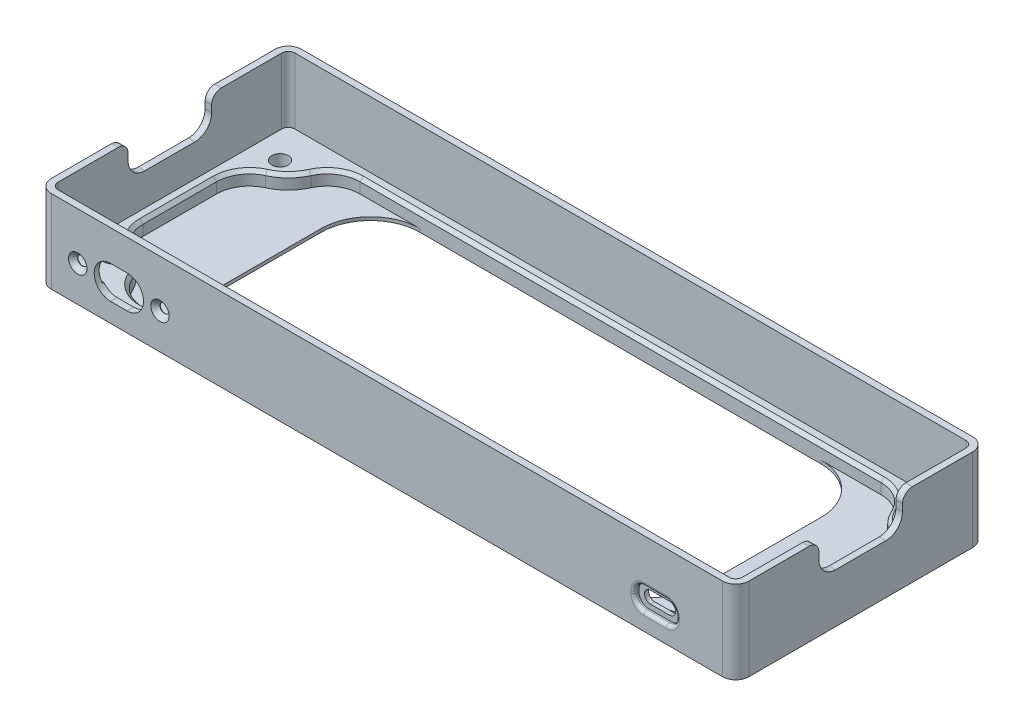
from build123d import *

# Parameters (mm, degrees)
BOSS_EXTRUDE1_DEPTH = 5.2
FILLET1_R           = 10
BOSS_EXTRUDE2_DEPTH = 1
SKETCH2_R           = 2.5
CUT_EXTRUDE1_DEPTH  = 5.2
BOSS_EXTRUDE3_DEPTH = 20
SKETCH7_W           = 15.78
SKETCH7_H           = 10
BOSS_EXTRUDE5_DEPTH = 0.75
CUT_EXTRUDE2_DEPTH  = 10
CUT_EXTRUDE3_DEPTH  = 1.5
FILLET6_R           = 1
CHAMFER1_SIZE       = 1
CUT_EXTRUDE4_DEPTH  = 3
SKETCH11_R          = 1.4
CUT_EXTRUDE5_DEPTH  = 3.5
CHAMFER2_SIZE       = 1.4
CUT_EXTRUDE6_DEPTH  = 0.5
CHAMFER3_SIZE       = 1
SKETCH13_W          = 25.4
SKETCH13_H          = 10.2
CUT_EXTRUDE7_DEPTH  = 217.847965174
FILLET7_R           = 5.1
FILLET8_R           = 3
FILLET9_R           = 15


with BuildPart() as part:
    # Sketch1 → Boss-Extrude1 (new body)
    with BuildSketch(Plane(origin=(0, 0, 0), x_dir=(1, 0, 0), z_dir=(0, 1, 0))):
        with BuildLine():
            ThreePointArc((-106, -34), (-104.828427125, -36.828427125), (-102, -38))
            Line((-102, -38), (102, -38))
            ThreePointArc((102, -38), (104.828427125, -36.828427125), (106, -34))
            Line((106, -34), (106, 34))
            ThreePointArc((106, 34), (104.828427125, 36.828427125), (102, 38))
            Line((102, 38), (-102, 38))
            ThreePointArc((-102, 38), (-104.828427125, 36.828427125), (-106, 34))
            Line((-106, 34), (-106, -34))
        make_face()
        with BuildLine():
            ThreePointArc((-87, -33), (-91.100505063, -23.100505063), (-101, -19))
            Line((-101, -19), (-101, 19))
            ThreePointArc((-101, 19), (-91.100505063, 23.100505063), (-87, 33))
            Line((-87, 33), (87, 33))
            ThreePointArc((87, 33), (91.100505063, 23.100505063), (101, 19))
            Line((101, 19), (101, -19))
            ThreePointArc((101, -19), (91.100505063, -23.100505063), (87, -33))
            Line((87, -33), (-87, -33))
        make_face(mode=Mode.SUBTRACT)
    extrude(amount=BOSS_EXTRUDE1_DEPTH)

    # Fillet1
    fillet1_edges = [part.edges().sort_by_distance(p)[0] for p in [
        (101, 2.6, -19),
        (87, 2.6, -33),
        (-87, 2.6, -33),
        (-101, 2.6, -19),
        (-101, 2.6, 19),
        (-87, 2.6, 33),
        (87, 2.6, 33),
        (101, 2.6, 19),
    ]]
    fillet(fillet1_edges, radius=FILLET1_R)

    # Sketch3 → Boss-Extrude2 (add)
    with BuildSketch(Plane(origin=(0, 0, 0), x_dir=(-1, 0, 0), z_dir=(0, -1, 0))):
        with BuildLine():
            Line((-102, -38), (-76, -38))
            Line((-76, -38), (-76, 38))
            Line((-76, 38), (-102, 38))
            ThreePointArc((-102, 38), (-104.828427125, 36.828427125), (-106, 34))
            Line((-106, 34), (-106, -34))
            ThreePointArc((-106, -34), (-104.828427125, -36.828427125), (-102, -38))
        make_face()
        with BuildLine():
            Line((102, -38), (76, -38))
            Line((76, -38), (76, 38))
            Line((76, 38), (102, 38))
            ThreePointArc((102, 38), (104.828427125, 36.828427125), (106, 34))
            Line((106, 34), (106, -34))
            ThreePointArc((106, -34), (104.828427125, -36.828427125), (102, -38))
        make_face()
    extrude(amount=-BOSS_EXTRUDE2_DEPTH)

    # Sketch2 → Cut-Extrude1 (cut)
    with BuildSketch(Plane(origin=(0, 5.2, 0), x_dir=(1, 0, 0), z_dir=(0, 1, 0))):
        with Locations(Location((-96, 25.5, 0), (0, 0, 270))):
            Circle(SKETCH2_R)
        with Locations(Location((96, 25.5, 0), (0, 0, 90))):
            Circle(SKETCH2_R)
        with Locations(Location((96, -25.5, 0), (0, 0, 270))):
            Circle(SKETCH2_R)
        with Locations(Location((-96, -25.5, 0), (0, 0, 90))):
            Circle(SKETCH2_R)
    extrude(amount=-CUT_EXTRUDE1_DEPTH, mode=Mode.SUBTRACT)

    # Sketch4 → Boss-Extrude3 (add)
    with BuildSketch(Plane(origin=(0, 5.2, 0), x_dir=(1, 0, 0), z_dir=(0, 1, 0))):
        with BuildLine():
            Line((-102, 38), (102, 38))
            ThreePointArc((102, 38), (104.828427125, 36.828427125), (106, 34))
            Line((106, 34), (106, -34))
            ThreePointArc((106, -34), (104.828427125, -36.828427125), (102, -38))
            Line((102, -38), (-102, -38))
            ThreePointArc((-102, -38), (-104.828427125, -36.828427125), (-106, -34))
            Line((-106, -34), (-106, 34))
            ThreePointArc((-106, 34), (-104.828427125, 36.828427125), (-102, 38))
        make_face()
        with BuildLine():
            Line((102, -36), (-102, -36))
            ThreePointArc((-102, -36), (-103.414213562, -35.414213562), (-104, -34))
            Line((-104, -34), (-104, 34))
            ThreePointArc((-104, 34), (-103.414213562, 35.414213562), (-102, 36))
            Line((-102, 36), (102, 36))
            ThreePointArc((102, 36), (103.414213562, 35.414213562), (104, 34))
            Line((104, 34), (104, -34))
            ThreePointArc((104, -34), (103.414213562, -35.414213562), (102, -36))
        make_face(mode=Mode.SUBTRACT)
    extrude(amount=BOSS_EXTRUDE3_DEPTH)

    # Sketch7 → Boss-Extrude5 (add)
    with BuildSketch(Plane(origin=(0, 0, 36), x_dir=(-1, 0, 0), z_dir=(0, 0, -1))):
        with Locations((-81.5, 10.2)):
            Rectangle(SKETCH7_W, SKETCH7_H)
    extrude(amount=BOSS_EXTRUDE5_DEPTH)

    # Sketch6 → Cut-Extrude2 (cut)
    with BuildSketch(Plane.XY.offset(38)):
        with BuildLine():
            Line((84.39, 10.34), (78.61, 10.34))
            ThreePointArc((78.61, 10.34), (76.78, 8.51), (78.61, 6.68))
            Line((78.61, 6.68), (84.39, 6.68))
            ThreePointArc((84.39, 6.68), (86.22, 8.51), (84.39, 10.34))
        make_face()
    extrude(amount=-CUT_EXTRUDE2_DEPTH, mode=Mode.SUBTRACT)

    # Sketch8 → Cut-Extrude3 (cut)
    with BuildSketch(Plane.XY.offset(38)):
        with BuildLine():
            Line((78.11, 11.84), (84.89, 11.84))
            ThreePointArc((84.89, 11.84), (87.011320344, 10.961320344), (87.89, 8.84))
            Line((87.89, 8.84), (87.89, 8.18))
            ThreePointArc((87.89, 8.18), (87.011320344, 6.058679656), (84.89, 5.18))
            Line((84.89, 5.18), (78.11, 5.18))
            ThreePointArc((78.11, 5.18), (75.988679656, 6.058679656), (75.11, 8.18))
            Line((75.11, 8.18), (75.11, 8.84))
            ThreePointArc((75.11, 8.84), (75.988679656, 10.961320344), (78.11, 11.84))
        make_face()
    extrude(amount=-CUT_EXTRUDE3_DEPTH, mode=Mode.SUBTRACT)

    # Fillet6
    fillet6_edges = [part.edges().sort_by_distance(p)[0] for p in [
        (87.011320344, 10.961320344, 38),
        (81.5, 11.84, 38),
        (75.988679656, 10.961320344, 38),
        (75.11, 8.51, 38),
        (75.988679656, 6.058679656, 38),
        (81.5, 5.18, 38),
        (87.011320344, 6.058679656, 38),
        (87.89, 8.51, 38),
    ]]
    fillet(fillet6_edges, radius=FILLET6_R)

    # Chamfer1
    # the kernel refuses this chamfer: 1 mm, written as the material it takes off along each edge
    with BuildSketch(Plane(origin=(89.39, 5.2, 35.25), x_dir=(0.027495876610582105, 0, 0.999621916911297), z_dir=(0, 1, 0))) as chamfer1_piece_1_section:
        Polygon((CHAMFER1_SIZE * 0.999621916911, -CHAMFER1_SIZE * 0.0274958766106), (-CHAMFER1_SIZE * 0.0274958766106, -CHAMFER1_SIZE * 0.999621916911), (0, 0), align=None)
    chamfer1_piece_1 = extrude(amount=12.571682988, mode=Mode.PRIVATE)
    chamfer1_piece_1 = split(chamfer1_piece_1, bisect_by=Plane(origin=(89.03804089, 11.485841494, 36), z_dir=(0, 0, -1)), keep=Keep.TOP, mode=Mode.PRIVATE)
    add(chamfer1_piece_1, mode=Mode.SUBTRACT)
    with BuildSketch(Plane(origin=(73.61, 17.771682988, 35.25), x_dir=(-0.027495876610582105, 0, 0.999621916911297), z_dir=(0, -1, 0))) as chamfer1_piece_2_section:
        Polygon((CHAMFER1_SIZE * 0.999621916911, -CHAMFER1_SIZE * 0.0274958766106), (-CHAMFER1_SIZE * 0.0274958766106, -CHAMFER1_SIZE * 0.999621916911), (0, 0), align=None)
    chamfer1_piece_2 = extrude(amount=12.571682988, mode=Mode.PRIVATE)
    chamfer1_piece_2 = split(chamfer1_piece_2, bisect_by=Plane(origin=(73.96195911, 11.485841494, 36), z_dir=(0, 0, -1)), keep=Keep.TOP, mode=Mode.PRIVATE)
    add(chamfer1_piece_2, mode=Mode.SUBTRACT)

    # Sketch9 → Cut-Extrude4 (cut)
    with BuildSketch(Plane.XY.offset(38)):
        with BuildLine():
            Line((-84, 15.81), (-79, 15.81))
            ThreePointArc((-79, 15.81), (-74, 10.81), (-79, 5.81))
            Line((-79, 5.81), (-84, 5.81))
            ThreePointArc((-84, 5.81), (-89, 10.81), (-84, 15.81))
        make_face()
    extrude(amount=-CUT_EXTRUDE4_DEPTH, mode=Mode.SUBTRACT)

    # Sketch11 → Cut-Extrude5 (cut)
    with BuildSketch(Plane.XY.offset(38)):
        with Locations((-94, 10.81)):
            Circle(SKETCH11_R)
        with Locations((-69, 10.81)):
            Circle(SKETCH11_R)
    extrude(amount=-CUT_EXTRUDE5_DEPTH, mode=Mode.SUBTRACT)

    # Chamfer2
    chamfer2_edges = [part.edges().sort_by_distance(p)[0] for p in [
        (-95.4, 10.81, 38),
        (-70.4, 10.81, 38),
    ]]
    chamfer(chamfer2_edges, length=CHAMFER2_SIZE)

    # Sketch12 → Cut-Extrude6 (cut)
    with BuildSketch(Plane(origin=(0, 0, 36), x_dir=(-1, 0, 0), z_dir=(0, 0, -1))):
        with BuildLine():
            Line((69, 13.81), (94, 13.81))
            ThreePointArc((94, 13.81), (97, 10.81), (94, 7.81))
            Line((94, 7.81), (69, 7.81))
            ThreePointArc((69, 7.81), (66, 10.81), (69, 13.81))
        make_face()
    extrude(amount=-CUT_EXTRUDE6_DEPTH, mode=Mode.SUBTRACT)

    # Chamfer3
    chamfer3_edges = [part.edges().sort_by_distance(p)[0] for p in [
        (0, 5.2, 33),
        (91.100505063, 5.2, 23.100505063),
        (101, 5.2, 0),
        (91.100505063, 5.2, -23.100505063),
        (0, 5.2, -33),
        (-91.100505063, 5.2, 23.100505063),
        (-101, 5.2, 0),
        (-91.100505063, 5.2, -23.100505063),
        (84.583193019, 5.2, 31.416254115),
        (99.416254115, 5.2, 16.583193019),
        (99.416254115, 5.2, -16.583193019),
        (84.583193019, 5.2, -31.416254115),
        (-84.583193019, 5.2, 31.416254115),
        (-99.416254115, 5.2, 16.583193019),
        (-84.583193019, 5.2, -31.416254115),
        (-99.416254115, 5.2, -16.583193019),
    ]]
    chamfer(chamfer3_edges, length=CHAMFER3_SIZE)

    # Sketch13 → Cut-Extrude7 (cut, through all)
    with BuildSketch(Plane(origin=(106, 0, 0), x_dir=(0, 0, -1), z_dir=(1, 0, 0))):
        with Locations((0, 20.1)):
            Rectangle(SKETCH13_W, SKETCH13_H)
    extrude(amount=-CUT_EXTRUDE7_DEPTH, mode=Mode.SUBTRACT)

    # Fillet7
    fillet7_edges = [part.edges().sort_by_distance(p)[0] for p in [
        (-105, 15, -12.7),
        (-105, 15, 12.7),
        (105, 15, -12.7),
        (105, 15, 12.7),
    ]]
    fillet(fillet7_edges, radius=FILLET7_R)

    # Fillet8
    fillet8_edges = [part.edges().sort_by_distance(p)[0] for p in [
        (-105, 25.2, -12.7),
        (-105, 25.2, 12.7),
        (105, 25.2, -12.7),
        (105, 25.2, 12.7),
    ]]
    fillet(fillet8_edges, radius=FILLET8_R)

    # Fillet9
    fillet9_edges = [part.edges().sort_by_distance(p)[0] for p in [
        (76, 0.5, 33),
        (76, 0.5, -33),
        (-76, 0.5, 33),
        (-76, 0.5, -33),
    ]]
    fillet(fillet9_edges, radius=FILLET9_R)


solid = part.part
